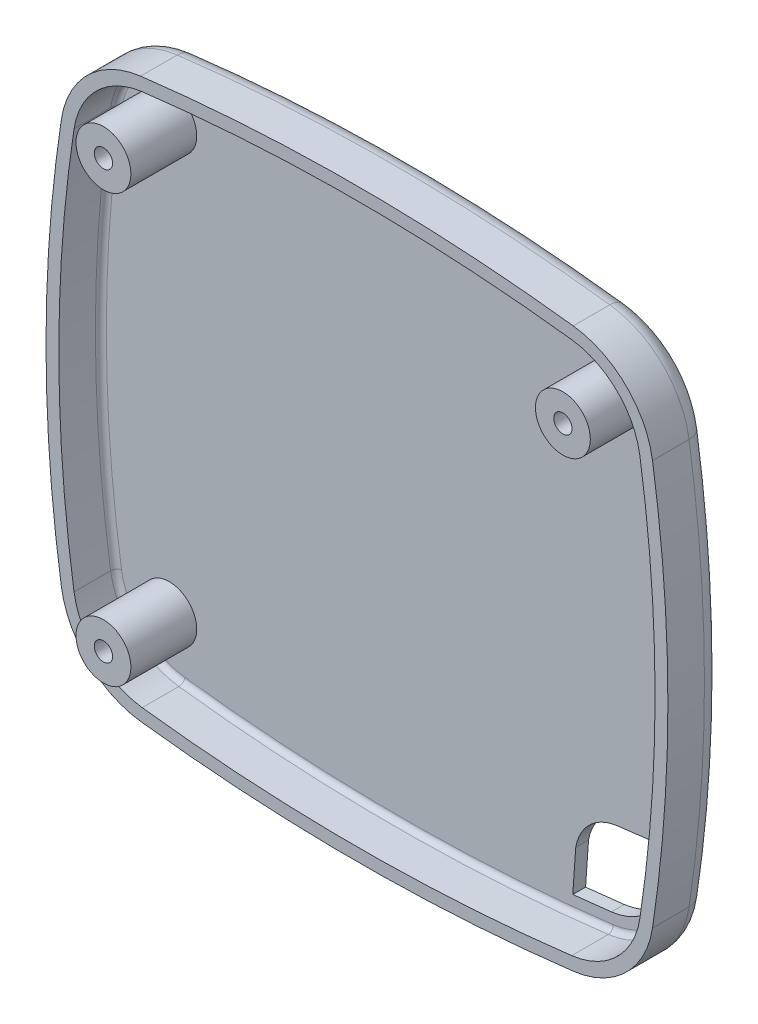
from build123d import *

# Parameters (mm, degrees)
IZIM1_W                           = 34
IZIM1_H                           = 32
Y_KSEKLIK_EKSTR_ZYON1_DEPTH       = 1.5
KES_EKSTR_ZYON1_DEPTH             = 24.537204592
KES_EKSTR_ZYON2_DEPTH             = 24.537204592
RADYUS1_R                         = 5
RADYUS2_R                         = 1
BO_ALTMA1_T                       = -0.7
Y_KSEKLIK_EKSTR_ZYON19_START      = -2.135
Y_KSEKLIK_EKSTR_ZYON19_OUTLINE_R  = 0.75
Y_KSEKLIK_EKSTR_ZYON19_DEPTH      = 0.635
Y_KSEKLIK_EKSTR_ZYON22_DEPTH      = 0.1
Y_KSEKLIK_EKSTR_ZYON22_DEPTH_BACK = 0.2
IZIM33_R                          = 4
IZIM34_R                          = 0.763160631
Y_KSEKLIK_EKSTR_ZYON23_DEPTH      = 0.2
KES_EKSTR_ZYON9_DEPTH             = 10
KES_EKSTR_ZYON9_DEPTH_BACK        = 10
RADYUS11_R                        = 0.6
RADYUS12_R                        = 0.6
RADYUS13_R                        = 0.6
RADYUS14_R                        = 0.6
RADYUS15_R                        = 0.6
Y_KSEKLIK_EKSTR_ZYON25_DEPTH      = 0.2
IZIM41_R                          = 1.5
IZIM41_R_2                        = 0.5
Y_KSEKLIK_EKSTR_ZYON26_DEPTH      = 3.6
RADYUS16_R                        = 0.5


# Read off the part's stored shape, not the designer's step: Yükseklik-Ekstrüzyon19
with BuildPart() as part:
    # Çizim1 → Yükseklik-Ekstrüzyon1 (new, symmetric)
    with BuildSketch(Plane.XY):
        Rectangle(IZIM1_W, IZIM1_H)
    extrude(amount=Y_KSEKLIK_EKSTR_ZYON1_DEPTH, both=True)

    # Çizim2 → Kes-Ekstrüzyon1 (cut, through all)
    with BuildSketch(Plane.XY.offset(1.5)):
        with BuildLine():
            Line((17, 16), (0, 16))
            ThreePointArc((0, 16), (8.533024083, 15.62427294), (17, 14.5))
            Line((17, 14.5), (17, 16))
        make_face()
        with BuildLine():
            Line((0, 16), (-17, 16))
            Line((-17, 16), (-17, 14.5))
            ThreePointArc((-17, 14.5), (-8.533024083, 15.62427294), (0, 16))
        make_face()
        with BuildLine():
            ThreePointArc((0, -16), (-8.533024083, -15.62427294), (-17, -14.5))
            Line((-17, -14.5), (-17, -16))
            Line((-17, -16), (0, -16))
        make_face()
        with BuildLine():
            Line((17, -16), (17, -14.5))
            ThreePointArc((17, -14.5), (8.533024083, -15.62427294), (0, -16))
            Line((0, -16), (17, -16))
        make_face()
    extrude(amount=-KES_EKSTR_ZYON1_DEPTH, mode=Mode.SUBTRACT)

    # Çizim3 → Kes-Ekstrüzyon2 (cut, through all)
    with BuildSketch(Plane.XY.offset(1.5)):
        with BuildLine():
            Line((17, 0), (17, 14.5))
            ThreePointArc((17, 14.5), (16.250498906, 14.630275398), (15.5, 14.754673799))
            ThreePointArc((15.5, 14.754673799), (16.62403604, 7.415362414), (17, 0))
        make_face()
        with BuildLine():
            Line((17, -14.5), (17, 0))
            ThreePointArc((17, 0), (16.62403604, -7.415362414), (15.5, -14.754673799))
            ThreePointArc((15.5, -14.754673799), (16.250498906, -14.630275398), (17, -14.5))
        make_face()
        with BuildLine():
            ThreePointArc((-17, -14.5), (-16.250498906, -14.630275398), (-15.5, -14.754673799))
            ThreePointArc((-15.5, -14.754673799), (-16.62403604, -7.415362414), (-17, 0))
            Line((-17, 0), (-17, -14.5))
        make_face()
        with BuildLine():
            ThreePointArc((-17, 0), (-16.62403604, 7.415362414), (-15.5, 14.754673799))
            ThreePointArc((-15.5, 14.754673799), (-16.250498906, 14.630275398), (-17, 14.5))
            Line((-17, 14.5), (-17, 0))
        make_face()
    extrude(amount=-KES_EKSTR_ZYON2_DEPTH, mode=Mode.SUBTRACT)

    # Radyus1
    radyus1_edges = [part.edges().sort_by_distance(p)[0] for p in [
        (15.5, 14.754673799, 0),
        (15.5, -14.754673799, 0),
        (-15.5, -14.754673799, 0),
        (-15.5, 14.754673799, 0),
    ]]
    fillet(radyus1_edges, radius=RADYUS1_R)

    # Radyus2
    radyus2_edges = [part.edges().sort_by_distance(p)[0] for p in [
        (-17, 0, -1.5),
        (0, -16, -1.5),
        (0, 16, -1.5),
        (17, 0, -1.5),
        (14.700011462, 13.901460449, -1.5),
        (-14.700011462, 13.901460449, -1.5),
        (14.700011462, -13.901460449, -1.5),
        (-14.700011462, -13.901460449, -1.5),
    ]]
    fillet(radyus2_edges, radius=RADYUS2_R)

    # İç Boşaltma1
    bo_altma1_openings = [part.faces().sort_by_distance(p)[0] for p in [
        (0, 0, 1.5),
    ]]
    offset(amount=BO_ALTMA1_T, openings=bo_altma1_openings)

    # Yükseklik-Ekstrüzyon19 outline → Yükseklik-Ekstrüzyon19 (add)
    with BuildSketch(Plane.XY.offset(Y_KSEKLIK_EKSTR_ZYON19_START)):
        with Locations((-3.477427824, 5.810074784)):
            Circle(Y_KSEKLIK_EKSTR_ZYON19_OUTLINE_R)
        with Locations((-3.47714914, 8.350074768)):
            Circle(Y_KSEKLIK_EKSTR_ZYON19_OUTLINE_R)
        with Locations((4.122527123, 5.836243547)):
            Circle(Y_KSEKLIK_EKSTR_ZYON19_OUTLINE_R)
        with Locations((4.122527123, 8.356279611)):
            Circle(Y_KSEKLIK_EKSTR_ZYON19_OUTLINE_R)
        with Locations((6.662516287, 8.348860337)):
            Circle(Y_KSEKLIK_EKSTR_ZYON19_OUTLINE_R)
    extrude(amount=Y_KSEKLIK_EKSTR_ZYON19_DEPTH)

    # Çizim33 → Yükseklik-Ekstrüzyon22 (add, two sides: drawn at the far end of the back side and taken through both)
    with BuildSketch(Plane(origin=(0, 0, -1.5), x_dir=(-1, 0, 0), z_dir=(0, 0, -1)).offset(-Y_KSEKLIK_EKSTR_ZYON22_DEPTH_BACK)):
        Circle(IZIM33_R)
    extrude(amount=Y_KSEKLIK_EKSTR_ZYON22_DEPTH + Y_KSEKLIK_EKSTR_ZYON22_DEPTH_BACK)

    # Çizim34 → Yükseklik-Ekstrüzyon23 (add)
    with BuildSketch(Plane(origin=(0, 0, -1.5), x_dir=(-1, 0, 0), z_dir=(0, 0, -1))):
        with BuildLine():
            Line((0.027336628, 2.861605141), (-1.401212018, -0.947248028))
            ThreePointArc((-1.401212018, -0.947248028), (0.005919763, -2.982166857), (1.421122311, -0.952852628))
            Line((1.421122311, -0.952852628), (0.027336628, 2.861605141))
        make_face()
        with Locations((0.008910459, -1.476128629)):
            Circle(IZIM34_R, mode=Mode.SUBTRACT)
    extrude(amount=Y_KSEKLIK_EKSTR_ZYON23_DEPTH)

    # Çizim39 → Kes-Ekstrüzyon9 (cut, two sides: drawn at the far end of the back side and taken through both)
    with BuildSketch(Plane.XY.offset(-0.8).offset(-KES_EKSTR_ZYON9_DEPTH_BACK)):
        with BuildLine():
            Line((14.610213976, -10.832519649), (14.849449262, -9.129608957))
            Line((14.849449262, -9.129608957), (11.909214028, -9.492992077))
            ThreePointArc((11.909214028, -9.492992077), (10.425985698, -10.199244767), (9.66221442, -11.653690564))
            Line((9.66221442, -11.653690564), (9.499568781, -13.959093444))
            Line((9.499568781, -13.959093444), (11.616606235, -13.723623976))
            ThreePointArc((11.616606235, -13.723623976), (13.601510507, -12.783477697), (14.610213976, -10.832519649))
        make_face()
    extrude(amount=KES_EKSTR_ZYON9_DEPTH + KES_EKSTR_ZYON9_DEPTH_BACK, mode=Mode.SUBTRACT)

    # Radyus11
    radyus11_edges = [part.edges().sort_by_distance(p)[0] for p in [
        (-4.227427824, 5.810074784, -2.135),
    ]]
    fillet(radyus11_edges, radius=RADYUS11_R)

    # Radyus12
    radyus12_edges = [part.edges().sort_by_distance(p)[0] for p in [
        (-4.22714914, 8.350074768, -2.135),
    ]]
    fillet(radyus12_edges, radius=RADYUS12_R)

    # Radyus13
    radyus13_edges = [part.edges().sort_by_distance(p)[0] for p in [
        (3.372527123, 5.836243547, -2.135),
    ]]
    fillet(radyus13_edges, radius=RADYUS13_R)

    # Radyus14
    radyus14_edges = [part.edges().sort_by_distance(p)[0] for p in [
        (3.372527123, 8.356279611, -2.135),
    ]]
    fillet(radyus14_edges, radius=RADYUS14_R)

    # Radyus15
    radyus15_edges = [part.edges().sort_by_distance(p)[0] for p in [
        (5.912516287, 8.348860337, -2.135),
    ]]
    fillet(radyus15_edges, radius=RADYUS15_R)

    # Çizim40 → Yükseklik-Ekstrüzyon25 (add)
    # profile 1 of 6: a face of its own
    with BuildSketch(Plane(origin=(0, 0, -1.5), x_dir=(-1, 0, 0), z_dir=(0, 0, -1))):
        Polygon((6.741915176, -10.664449862), (7.843072545, -10.664449862), (7.843072545, -9.8290891), (6.800058184, -9.8290891), (6.800058184, -9.52532155), (7.843072545, -9.52532155), (7.843072545, -8.348222295), (8.222781982, -8.348222295), (8.222781982, -10.968217412), (6.741915176, -10.968217412), align=None)
    # profile 2 of 6: a face of its own
    with BuildSketch(Plane(origin=(0, 0, -1.5), x_dir=(-1, 0, 0), z_dir=(0, 0, -1))):
        Polygon((5.45090309, -10.664449862), (6.058438189, -10.664449862), (6.058438189, -10.968217412), (4.463658553, -10.968217412), (4.463658553, -10.664449862), (5.071193652, -10.664449862), (5.071193652, -8.651989844), (4.463658553, -8.651989844), (4.463658553, -8.348222295), (6.058438189, -8.348222295), (6.058438189, -8.651989844), (5.45090309, -8.651989844), align=None)
    # profile 3 of 6: a face of its own
    with BuildSketch(Plane(origin=(0, 0, -1.5), x_dir=(-1, 0, 0), z_dir=(0, 0, -1))):
        Polygon((2.147430985, -8.348222295), (2.648766102, -8.348222295), (3.350041969, -9.986312539), (3.552355903, -10.512566087), (3.552355903, -9.188329425), (3.552355903, -8.348222295), (3.932065341, -8.348222295), (3.932065341, -10.968217412), (3.436663184, -10.968217412), (2.768611893, -9.407848943), (2.527140423, -8.803873619), (2.527140423, -10.218291273), (2.527140423, -10.968217412), (2.147430985, -10.968217412), align=None)
    # profile 4 of 6: a face of its own
    with BuildSketch(Plane(origin=(0, 0, -1.5), x_dir=(-1, 0, 0), z_dir=(0, 0, -1))):
        with BuildLine():
            add(Edge.make_bspline(
                [(-0.206767526, -9.687291357), (-0.205518524, -9.625717132), (-0.203068419, -9.504930026), (-0.183958307, -9.356304096), (-0.162157259, -9.242120238), (-0.140748967, -9.160321856), (-0.114923391, -9.081592081), (-0.085857422, -9.00542897), (-0.050194389, -8.933140722), (-0.011670697, -8.863282091), (0.033581336, -8.798107842), (0.082098485, -8.735389592), (0.136004859, -8.676101252), (0.197004324, -8.622651751), (0.262443686, -8.572020298), (0.334551461, -8.527067916), (0.412587752, -8.48706524), (0.495764953, -8.450093855), (0.585917473, -8.420665437), (0.681575287, -8.394110835), (0.783861313, -8.373466788), (0.892854061, -8.358812566), (1.008546362, -8.349816601), (1.087985384, -8.348762899), (1.128741761, -8.348222295)],
                knots=[0, 0, 0, 0, 1.874770978, 3.677645334, 4.555394571, 5.414487718, 6.250744093, 7.078518084, 7.894837726, 8.704014156, 9.50598375, 10.308496101, 11.118501685, 11.941902574, 12.775616767, 13.636334489, 14.525420061, 15.445315287, 16.405376085, 17.410760046, 18.468073069, 19.580652696, 20.758748205, 22, 22, 22, 22], degree=3))
            Line((1.128741761, -8.348222295), (1.691779661, -8.348222295))
            Line((1.691779661, -8.348222295), (1.691779661, -10.968217412))
            Line((1.691779661, -10.968217412), (1.014235634, -10.968217412))
            add(Edge.make_bspline(
                [(1.014235634, -10.968217412), (0.964559321, -10.967400938), (0.86813461, -10.965816114), (0.728405814, -10.9509137), (0.598433312, -10.926040549), (0.477952679, -10.892120811), (0.367482973, -10.847276067), (0.266345618, -10.793453175), (0.175312504, -10.728751209), (0.094002553, -10.654006767), (0.02221258, -10.569230131), (-0.039086687, -10.473600988), (-0.091694394, -10.368135675), (-0.133206001, -10.251584588), (-0.166631071, -10.125204092), (-0.189818816, -9.988394755), (-0.204294626, -9.841267712), (-0.205925268, -9.739734929), (-0.206767526, -9.687291357)],
                knots=[0, 0, 0, 0, 1.171804566, 2.274543161, 3.31047596, 4.291127812, 5.222611275, 6.118249426, 6.988312707, 7.850242438, 8.71774943, 9.601740169, 10.524097841, 11.492438693, 12.515597897, 13.604927327, 14.762900395, 16, 16, 16, 16], degree=3))
        make_face()
        with BuildLine():
            add(Edge.make_bspline(
                [(0.172941912, -9.657033261), (0.173323107, -9.701755096), (0.17405622, -9.787763991), (0.184812076, -9.911087009), (0.199325934, -10.024069444), (0.221885777, -10.126476761), (0.250796487, -10.219121669), (0.286263426, -10.302241092), (0.328651051, -10.375956228), (0.377457048, -10.441012751), (0.433900927, -10.496341205), (0.49620197, -10.544123849), (0.565807185, -10.582556624), (0.641839143, -10.613739385), (0.72485671, -10.636294369), (0.814307564, -10.653088366), (0.910616347, -10.662208133), (0.977038242, -10.663687475), (1.011269154, -10.664449862)],
                knots=[0, 0, 0, 0, 1.413317699, 2.71808822, 3.910861475, 5.012152221, 6.028496422, 6.975042758, 7.862971364, 8.710769282, 9.537488278, 10.35402632, 11.185366001, 12.043361187, 12.945960075, 13.899972198, 14.917738425, 16, 16, 16, 16], degree=3))
            Line((1.011269154, -10.664449862), (1.312070223, -10.664449862))
            Line((1.312070223, -10.664449862), (1.312070223, -8.651989844))
            Line((1.312070223, -8.651989844), (1.050426689, -8.651989844))
            add(Edge.make_bspline(
                [(1.050426689, -8.651989844), (1.015004197, -8.652876867), (0.946149629, -8.654601069), (0.846095434, -8.665338129), (0.753268425, -8.685851261), (0.667077677, -8.71299808), (0.587521458, -8.747831758), (0.515228491, -8.791680112), (0.449452035, -8.842817605), (0.390730824, -8.90231765), (0.338938171, -8.969676769), (0.294422011, -9.045179339), (0.256314015, -9.128020943), (0.225559803, -9.218724971), (0.202076496, -9.317288883), (0.18498098, -9.423567829), (0.174997752, -9.537787667), (0.173641213, -9.616471424), (0.172941912, -9.657033261)],
                knots=[0, 0, 0, 0, 1.112368836, 2.162232858, 3.153671654, 4.092370021, 4.995862172, 5.873374016, 6.740409183, 7.605418486, 8.490978658, 9.401506614, 10.351738463, 11.349303293, 12.403565438, 13.529577563, 14.726485918, 16, 16, 16, 16], degree=3))
        make_face(mode=Mode.SUBTRACT)
    # profile 5 of 6: a face of its own
    with BuildSketch(Plane(origin=(0, 0, -1.5), x_dir=(-1, 0, 0), z_dir=(0, 0, -1))):
        Polygon((-2.453579462, -8.348222295), (-2.105314712, -8.348222295), (-2.06556388, -10.009451083), (-2.048358296, -10.605713558), (-1.924359433, -10.250922553), (-1.53219078, -9.183583057), (-1.285379646, -9.183583057), (-0.917536129, -10.210578425), (-0.795317153, -10.605713558), (-0.78701101, -9.980972875), (-0.738360738, -8.348222295), (-0.401961908, -8.348222295), (-0.532487027, -10.968217412), (-0.955507072, -10.968217412), (-1.307924894, -9.953681259), (-1.421837725, -9.611349469), (-1.533970668, -9.953681259), (-1.910120329, -10.968217412), (-2.344412998, -10.968217412), align=None)
    # profile 6 of 6: a face of its own
    with BuildSketch(Plane(origin=(0, 0, -1.5), x_dir=(-1, 0, 0), z_dir=(0, 0, -1))):
        Polygon((-4.459513223, -8.348222295), (-2.978646418, -8.348222295), (-2.978646418, -10.968217412), (-4.459513223, -10.968217412), (-4.459513223, -10.664449862), (-3.358355855, -10.664449862), (-3.358355855, -9.867060044), (-4.415609319, -9.867060044), (-4.415609319, -9.563292494), (-3.358355855, -9.563292494), (-3.358355855, -8.651989844), (-4.459513223, -8.651989844), align=None)
    extrude(amount=Y_KSEKLIK_EKSTR_ZYON25_DEPTH)

    # Çizim41 → Yükseklik-Ekstrüzyon26 (add)
    # profile 1 of 3: a face of its own
    with BuildSketch(Plane.XY.offset(-0.8)):
        with Locations(Location((-12.559589473, -11.676004183, 0), (0, 0, 180))):
            Circle(IZIM41_R)
        with Locations((-12.559589473, -11.676004183)):
            Circle(IZIM41_R_2, mode=Mode.SUBTRACT)
    # profile 2 of 3: a face of its own
    with BuildSketch(Plane.XY.offset(-0.8)):
        with Locations(Location((-12.559589473, 11.676004183, 0), (0, 0, 180))):
            Circle(IZIM41_R)
        with Locations((-12.559589473, 11.676004183)):
            Circle(IZIM41_R_2, mode=Mode.SUBTRACT)
    # profile 3 of 3: a face of its own
    with BuildSketch(Plane.XY.offset(-0.8)):
        with Locations(Location((12.559589473, 11.676004183, 0), (0, 0, 180))):
            Circle(IZIM41_R)
        with Locations((12.559589473, 11.676004183)):
            Circle(IZIM41_R_2, mode=Mode.SUBTRACT)
    extrude(amount=Y_KSEKLIK_EKSTR_ZYON26_DEPTH)

    # Radyus16
    radyus16_edges = [part.edges().sort_by_distance(p)[0] for p in [
        (-13.059589473, -11.676004183, -0.8),
        (-13.059589473, 11.676004183, -0.8),
        (12.059589473, 11.676004183, -0.8),
    ]]
    fillet(radyus16_edges, radius=RADYUS16_R)


solid = part.part
